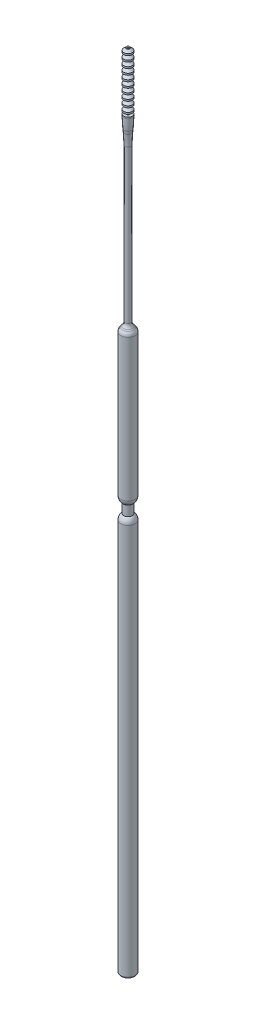
from build123d import *

# Parameters (mm, degrees)
SKETCH2_R           = 0.5
BOSS_EXTRUDE1_DEPTH = 5
FILLET1_R           = 20
SKETCH5_W           = 0.25
SKETCH5_H           = 0.25
BOSS_EXTRUDE3_DEPTH = 1
MOVE_FACE1_BY       = 0.25
BOSS_EXTRUDE4_START = 21.5
SKETCH8_R           = 0.5
BOSS_EXTRUDE4_DEPTH = 21.5
FILLET6_R           = 0.25
FILLET7_R           = 1
LPATTERN1_COUNT     = 10
LPATTERN1_PITCH     = 1
FILLET8_R           = 0.1


with BuildPart() as part:
    # Sketch2 → Boss-Extrude1 (new body)
    with BuildSketch(Plane(origin=(0, 0, 0), x_dir=(1, 0, 0), z_dir=(0, 1, 0))):
        with Locations(Location((0, 0, 0), (0, 0, 270))):
            Circle(SKETCH2_R)
    extrude(amount=BOSS_EXTRUDE1_DEPTH)

    # Sketch4 → Revolve1 (revolve)
    with BuildSketch(Plane(origin=(0, 0, 0), x_dir=(0, 0, -1), z_dir=(1, 0, 0))):
        Polygon((0, 5), (0, 10.5), (0.75, 10.5), (0.75, 9), (0.5, 6.5), (0.5, 5), align=None)
    revolve(axis=Axis((0, 5, 0), (0, 1, 0)))

    # Fillet1
    # the kernel refuses this fillet: 20 mm, written as the material it adds along each edge
    with BuildSketch(Plane(origin=(0, 6.5, 0), x_dir=(0, 0, -1), z_dir=(1, 0, 0))) as fillet1_piece_1:
        with BuildLine():
            CenterArc((0.5 + FILLET1_R, -FILLET1_R * 0.0498756211209), FILLET1_R, 174.289406863, 5.710593137)
            Line((0.5 + FILLET1_R * 0.00496280979001, FILLET1_R * 0.0496280979001), (0.5, 0))
            Line((0.5, 0), (0.5, -FILLET1_R * 0.0498756211209))
        make_face()
    revolve(axis=Axis((0, 6.5, 0), (0, 1, 0)))
    # the kernel refuses this fillet: 20 mm, written as the material it takes off along each edge
    with BuildSketch(Plane(origin=(0, 9, 0), x_dir=(0, 0, -1), z_dir=(1, 0, 0))) as fillet1_2_piece_1:
        with BuildLine():
            CenterArc((0.75 - FILLET1_R, FILLET1_R * 0.0498756211209), FILLET1_R, 354.289406863, 5.710593137)
            Line((0.75, FILLET1_R * 0.0498756211209), (0.75, 0))
            Line((0.75, 0), (0.75 - FILLET1_R * 0.00496280979001, -FILLET1_R * 0.0496280979001))
        make_face()
    revolve(axis=Axis((0, 9, 0), (0, 1, 0)), mode=Mode.SUBTRACT)

    # Sketch5 → Boss-Extrude3 (add)
    with BuildSketch(Plane(origin=(0, 10.5, 0), x_dir=(1, 0, 0), z_dir=(0, 1, 0))):
        with BuildLine():
            ThreePointArc((0.125, 0.216506351), (0, 0.25), (-0.125, 0.216506351))
            Line((-0.125, 0.216506351), (-0.125, 0.125))
            Line((-0.125, 0.125), (0.125, 0.125))
            Line((0.125, 0.125), (0.125, 0.216506351))
        make_face()
        with BuildLine():
            Line((0.216506351, 0.125), (0.125, 0.125))
            Line((0.125, 0.125), (0.125, -0.125))
            Line((0.125, -0.125), (0.216506351, -0.125))
            ThreePointArc((0.216506351, -0.125), (0.241481457, -0.064704761), (0.25, 0))
            ThreePointArc((0.25, 0), (0.241481457, 0.064704761), (0.216506351, 0.125))
        make_face()
        with BuildLine():
            ThreePointArc((0.216506351, 0.125), (0.176776695, 0.176776695), (0.125, 0.216506351))
            Line((0.125, 0.216506351), (0.125, 0.125))
            Line((0.125, 0.125), (0.216506351, 0.125))
        make_face()
        with BuildLine():
            Line((0.216506351, -0.125), (0.125, -0.125))
            Line((0.125, -0.125), (0.125, -0.216506351))
            ThreePointArc((0.125, -0.216506351), (0.176776695, -0.176776695), (0.216506351, -0.125))
        make_face()
        with BuildLine():
            Line((0.125, -0.125), (-0.125, -0.125))
            Line((-0.125, -0.125), (-0.125, -0.216506351))
            ThreePointArc((-0.125, -0.216506351), (0, -0.25), (0.125, -0.216506351))
            Line((0.125, -0.216506351), (0.125, -0.125))
        make_face()
        Rectangle(SKETCH5_W, SKETCH5_H)
        with BuildLine():
            Line((-0.125, -0.125), (-0.125, 0.125))
            Line((-0.125, 0.125), (-0.216506351, 0.125))
            ThreePointArc((-0.216506351, 0.125), (-0.25, 0), (-0.216506351, -0.125))
            Line((-0.216506351, -0.125), (-0.125, -0.125))
        make_face()
        with BuildLine():
            Line((-0.125, 0.125), (-0.125, 0.216506351))
            ThreePointArc((-0.125, 0.216506351), (-0.176776695, 0.176776695), (-0.216506351, 0.125))
            Line((-0.216506351, 0.125), (-0.125, 0.125))
        make_face()
        with BuildLine():
            Line((-0.125, -0.216506351), (-0.125, -0.125))
            Line((-0.125, -0.125), (-0.216506351, -0.125))
            ThreePointArc((-0.216506351, -0.125), (-0.176776695, -0.176776695), (-0.125, -0.216506351))
        make_face()
    boss_extrude3 = extrude(amount=BOSS_EXTRUDE3_DEPTH)

    # Sketch10 → Revolve5 (revolve)
    with BuildSketch(Plane.XY):
        Polygon((0, 11.5), (0.75, 10.974844346), (0.75, 10.669650699), (0, 11.194806353), align=None)
    revolve5 = revolve(axis=Axis((0, 11.5, 0), (0, -1, 0)))

    # Move Face1: a face moved inward by 0.25
    extrude(part.faces().sort_by_distance((0.375, 10.5, 0))[0], amount=MOVE_FACE1_BY, dir=(0, -1, 0), mode=Mode.SUBTRACT)

    # Sketch8 → Boss-Extrude4 (add)
    with BuildSketch(Plane(origin=(0, 0, 0), x_dir=(-1, 0, 0), z_dir=(0, -1, 0)).offset(BOSS_EXTRUDE4_START)):
        with Locations(Location((0, 0, 0), (0, 0, 90))):
            Circle(SKETCH8_R)
    extrude(amount=-BOSS_EXTRUDE4_DEPTH)

    # Sketch9 → Revolve4 (revolve)
    with BuildSketch(Plane.XY, mode=Mode.PRIVATE) as revolve4_sk:
        with BuildLine():
            Line((0, -21.5), (-0.5, -21.5))
            Line((-0.5, -21.5), (-0.5, -22))
            Line((-0.5, -22), (-1.25, -22.75))
            Line((-1.25, -22.75), (-1.25, -23.25))
            Line((-1.25, -23.25), (-1.25, -48.25))
            ThreePointArc((-1.25, -48.25), (-1.118033989, -48.809016994), (-0.75, -49.25))
            Line((-0.75, -49.25), (-0.75, -51))
            ThreePointArc((-0.75, -51), (-1.118033989, -51.440983006), (-1.25, -52))
            Line((-1.25, -52), (-1.25, -120.25))
            Line((-1.25, -120.25), (-1.25, -121.5))
            Line((-1.25, -121.5), (0, -121.5))
            Line((0, -121.5), (0, -52))
            Line((0, -52), (0, -48.25))
            Line((0, -48.25), (0, -21.5))
        make_face()
    revolve(revolve4_sk.sketch.rotate(Axis((0, -21.5, 0), (0, -1, 0)), 270), axis=Axis((0, -21.5, 0), (0, -1, 0)))

    # Fillet6
    fillet6_edges = [part.edges().sort_by_distance(p)[0] for p in [
        (0, -121.5, -1.25),
    ]]
    fillet(fillet6_edges, radius=FILLET6_R)

    # Fillet7
    fillet7_edges = [part.edges().sort_by_distance(p)[0] for p in [
        (0, -22, -0.5),
        (0, -22.75, -1.25),
    ]]
    fillet(fillet7_edges, radius=FILLET7_R)

    # LPattern1: Boss-Extrude3, Revolve5 ×10
    with Locations(*[(0, i * LPATTERN1_PITCH, 0) for i in range(1, LPATTERN1_COUNT)]):
        add(boss_extrude3)
        add(revolve5)

    # Fillet8
    fillet8_edges = [part.edges().sort_by_distance(p)[0] for p in [
        (-0.064704761, 20.324948115, -0.241481457),
        (0.216506351, 20.5, -0.125),
    ]]
    fillet(fillet8_edges, radius=FILLET8_R)


solid = part.part
